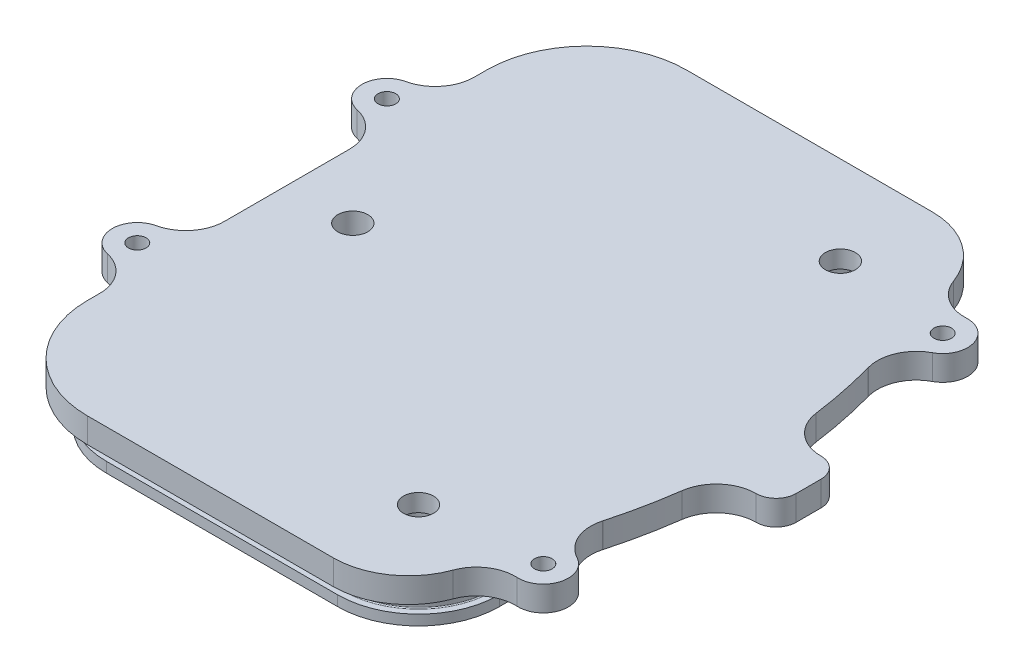
from build123d import *

# Parameters (mm, degrees)
SKETCH1_W           = 137.16
SKETCH1_H           = 152.4
BOSS_EXTRUDE1_DEPTH = 6.35
CUT_EXTRUDE1_DEPTH  = 6.35
FILLET1_R           = 25.4
FILLET2_R           = 19.05
FILLET3_R           = 127
SKETCH2_R           = 2.2479
CUT_EXTRUDE2_DEPTH  = 6.35
BOSS_EXTRUDE3_START = -6.35
BOSS_EXTRUDE3_DEPTH = 6.35
BOSS_EXTRUDE4_DEPTH = 8.7122
CUT_EXTRUDE3_START  = 2.54
SKETCH7_W           = 137.16
SKETCH7_H           = 152.4
CUT_EXTRUDE3_DEPTH  = 3.556
HOLE1_D             = 7.62
CUT_EXTRUDE4_DEPTH  = 10.6172
HOLE2_D             = 7.62
BOSS_EXTRUDE5_DEPTH = 10.6172
FILLET4_R           = 6.604
FILLET5_R           = 7.62
FILLET6_R           = 9.144
MIRROR2_START       = -15.0622
MIRROR2_DEPTH       = 10.6172
CHAMFER1_SIZE       = 1.016
FILLET7_R           = 0.254


# Read off the part's stored shape, not the designer's step: Mirror2
with BuildPart() as part:
    # Sketch1 → Boss-Extrude1 (new body)
    with BuildSketch(Plane(origin=(0, 0, 0), x_dir=(1, 0, 0), z_dir=(0, 1, 0))):
        Rectangle(SKETCH1_W, SKETCH1_H)
    extrude(amount=-BOSS_EXTRUDE1_DEPTH)

    # Sketch3 → Cut-Extrude1 (cut)
    with BuildSketch(Plane(origin=(0, 0, 0), x_dir=(1, 0, 0), z_dir=(0, 1, 0))):
        with BuildLine():
            Line((-54.821666667, 0), (-54.821666667, -15.887705084))
            ThreePointArc((-54.821666667, -15.887705084), (-56.994797895, -22.078955084), (-62.560729167, -25.553791048))
            ThreePointArc((-62.560729167, -25.553791048), (-67.521666667, -31.75), (-62.560729167, -37.946208952))
            ThreePointArc((-62.560729167, -37.946208952), (-56.994797895, -41.421044916), (-54.821666667, -47.612294916))
            Line((-54.821666667, -47.612294916), (-54.821666667, -76.2))
            Line((-54.821666667, -76.2), (-68.58, -76.2))
            Line((-68.58, -76.2), (-68.58, 0))
            Line((-68.58, 0), (-54.821666667, 0))
        make_face()
        with BuildLine():
            Line((68.58, 0), (59.262686671, -33.820874717))
            ThreePointArc((59.262686671, -33.820874717), (59.713399713, -40.366937171), (64.156526503, -45.195259885))
            ThreePointArc((64.156526503, -45.195259885), (67.293603318, -52.486532428), (60.865154116, -57.142598053))
            ThreePointArc((60.865154116, -57.142598053), (54.576224637, -59.014346409), (50.836773359, -64.406060426))
            Line((50.836773359, -64.406060426), (47.587660753, -76.2))
            Line((47.587660753, -76.2), (68.58, -76.2))
            Line((68.58, -76.2), (68.58, 0))
        make_face()
    cut_extrude1 = extrude(amount=-CUT_EXTRUDE1_DEPTH, mode=Mode.SUBTRACT)

    # Mirror1: Cut-Extrude1 across plane
    add(cut_extrude1.mirror(Plane(origin=(-54.821666667, -85.388713977, 0), x_dir=(1, 0, 0), z_dir=(0, 0, -1))), mode=Mode.SUBTRACT)

    # Fillet1
    fillet1_edges = [part.edges().sort_by_distance(p)[0] for p in [
        (-54.821666667, -3.175, 76.2),
        (-54.821666667, -3.175, -76.2),
    ]]
    fillet(fillet1_edges, radius=FILLET1_R)

    # Fillet2
    fillet2_edges = [part.edges().sort_by_distance(p)[0] for p in [
        (47.587660753, -3.175, -76.2),
        (47.587660753, -3.175, 76.2),
    ]]
    fillet(fillet2_edges, radius=FILLET2_R)

    # Fillet3
    fillet3_edges = [part.edges().sort_by_distance(p)[0] for p in [
        (68.58, -3.175, 0),
    ]]
    fillet(fillet3_edges, radius=FILLET3_R)

    # Sketch2 → Cut-Extrude2 (cut)
    with BuildSketch(Plane(origin=(0, 0, 0), x_dir=(1, 0, 0), z_dir=(0, 1, 0))):
        with Locations(Location((-61.171666667, 31.75, 0), (0, 0, 270))):
            Circle(SKETCH2_R)
        with Locations(Location((-61.171666667, -31.75, 0), (0, 0, 270))):
            Circle(SKETCH2_R)
        with Locations(Location((61.171666667, 50.8, 0), (0, 0, 270))):
            Circle(SKETCH2_R)
        with Locations(Location((61.171666667, -50.8, 0), (0, 0, 270))):
            Circle(SKETCH2_R)
    extrude(amount=-CUT_EXTRUDE2_DEPTH, mode=Mode.SUBTRACT)

    # Sketch4 → Boss-Extrude3 (add)
    with BuildSketch(Plane(origin=(0, 0, 0), x_dir=(1, 0, 0), z_dir=(0, 1, 0)).offset(BOSS_EXTRUDE3_START)):
        with BuildLine():
            Line((77.846996368, 3.175), (77.846996368, -3.175))
            ThreePointArc((77.846996368, -3.175), (76.359098817, -6.767102448), (72.766996368, -8.255))
            ThreePointArc((72.766996368, -8.255), (66.082439262, -10.763706234), (62.698982566, -17.050925926))
            ThreePointArc((62.698982566, -17.050925926), (63.848810039, 0), (62.698982566, 17.050925926))
            ThreePointArc((62.698982566, 17.050925926), (66.082439262, 10.763706234), (72.766996368, 8.255))
            ThreePointArc((72.766996368, 8.255), (76.359098817, 6.767102448), (77.846996368, 3.175))
        make_face()
    extrude(amount=BOSS_EXTRUDE3_DEPTH)

    # Sketch5 → Boss-Extrude4 (add)
    with BuildSketch(Plane.XZ.offset(6.35)):
        with BuildLine():
            Line((-49.970266667, 50.8), (-49.970266667, -50.8))
            ThreePointArc((-49.970266667, -50.8), (-43.951721071, -65.330054404), (-29.421666667, -71.3486))
            Line((-29.421666667, -71.3486), (29.421666667, -71.3486))
            ThreePointArc((29.421666667, -71.3486), (43.951721071, -65.330054404), (49.970266667, -50.8))
            Line((49.970266667, -50.8), (49.970266667, 50.8))
            ThreePointArc((49.970266667, 50.8), (43.951721071, 65.330054404), (29.421666667, 71.3486))
            Line((29.421666667, 71.3486), (-29.421666667, 71.3486))
            ThreePointArc((-29.421666667, 71.3486), (-43.951721071, 65.330054404), (-49.970266667, 50.8))
        make_face()
    extrude(amount=BOSS_EXTRUDE4_DEPTH)

    # Sketch7 → Cut-Extrude3 (cut)
    with BuildSketch(Plane.XZ.offset(6.35).offset(CUT_EXTRUDE3_START)):
        Rectangle(SKETCH7_W, SKETCH7_H)
        with BuildLine():
            Line((48.192266667, -50.8), (48.192266667, 50.8))
            ThreePointArc((48.192266667, 50.8), (42.694485214, 64.072818547), (29.421666667, 69.5706))
            Line((29.421666667, 69.5706), (-29.421666667, 69.5706))
            ThreePointArc((-29.421666667, 69.5706), (-42.694485214, 64.072818547), (-48.192266667, 50.8))
            Line((-48.192266667, 50.8), (-48.192266667, -50.8))
            ThreePointArc((-48.192266667, -50.8), (-42.694485214, -64.072818547), (-29.421666667, -69.5706))
            Line((-29.421666667, -69.5706), (29.421666667, -69.5706))
            ThreePointArc((29.421666667, -69.5706), (42.694485214, -64.072818547), (48.192266667, -50.8))
        make_face(mode=Mode.SUBTRACT)
    extrude(amount=CUT_EXTRUDE3_DEPTH, mode=Mode.SUBTRACT)

    # Hole1 (through all)
    with Locations(Plane.XZ.offset(15.0622)):
        with Locations((-38.1, 0)):
            Hole(HOLE1_D / 2)

    # Sketch11 → Cut-Extrude4 (cut)
    with BuildSketch(Plane.XZ.offset(15.0622)):
        with BuildLine():
            Line((-43.620266667, -8.529493298), (-43.620266667, -50.8))
            ThreePointArc((-43.620266667, -50.8), (-39.46159301, -60.839926343), (-29.421666667, -64.9986))
            Line((-29.421666667, -64.9986), (29.421666667, -64.9986))
            ThreePointArc((29.421666667, -64.9986), (39.46159301, -60.839926343), (43.620266667, -50.8))
            Line((43.620266667, -50.8), (43.620266667, 50.8))
            ThreePointArc((43.620266667, 50.8), (39.46159301, 60.839926343), (29.421666667, 64.9986))
            Line((29.421666667, 64.9986), (-29.421666667, 64.9986))
            ThreePointArc((-29.421666667, 64.9986), (-39.46159301, 60.839926343), (-43.620266667, 50.8))
            Line((-43.620266667, 50.8), (-43.620266667, 8.529493298))
            ThreePointArc((-43.620266667, 8.529493298), (-27.94, 0), (-43.620266667, -8.529493298))
        make_face()
    extrude(amount=-CUT_EXTRUDE4_DEPTH, mode=Mode.SUBTRACT)

    # Hole2 (through all)
    with Locations(Plane.XZ.offset(4.445)):
        with Locations((32.277388113, 53.655721447), (32.277388113, -53.655721447)):
            Hole(HOLE2_D / 2)

    # Sketch15 → Boss-Extrude5 (add)
    with BuildSketch(Plane.XZ.offset(4.445)):
        Polygon((20.847388113, 64.9986), (20.847388113, 42.225721446), (43.620266667, 42.225721446), (43.620266667, 44.765721446), (23.387388113, 44.765721446), (23.387388113, 64.9986), align=None)
    extrude(amount=BOSS_EXTRUDE5_DEPTH)

    # Fillet4
    fillet4_edges = [part.edges().sort_by_distance(p)[0] for p in [
        (43.620266667, -9.7536, 44.765721446),
        (23.387388113, -9.7536, 44.765721446),
        (23.387388113, -9.7536, 64.9986),
    ]]
    fillet(fillet4_edges, radius=FILLET4_R)

    # Fillet5
    fillet5_edges = [part.edges().sort_by_distance(p)[0] for p in [
        (-43.620266667, -9.7536, 8.529493298),
        (-43.620266667, -9.7536, -8.529493298),
        (43.620266667, -9.7536, 42.225721446),
        (20.847388113, -9.7536, 64.9986),
    ]]
    fillet(fillet5_edges, radius=FILLET5_R)

    # Fillet6
    fillet6_edges = [part.edges().sort_by_distance(p)[0] for p in [
        (20.847388113, -9.7536, 42.225721446),
    ]]
    fillet(fillet6_edges, radius=FILLET6_R)

    # Mirror2 outline → Mirror2 (add)
    with BuildSketch(Plane(origin=(0, 0, 0), x_dir=(1, 0, 0), z_dir=(0, 1, 0)).offset(MIRROR2_START)):
        with BuildLine():
            ThreePointArc((29.991388113, 44.765721447), (25.32165493, 46.699988264), (23.387388113, 51.369721447))
            Line((23.387388113, 51.369721447), (23.387388113, 64.9986))
            Line((23.387388113, 64.9986), (20.847388113, 64.9986))
            Line((20.847388113, 64.9986), (20.847388113, 51.369721447))
            ThreePointArc((20.847388113, 51.369721447), (23.525603705, 44.90393704), (29.991388113, 42.225721447))
            Line((29.991388113, 42.225721447), (36.000266667, 42.225721446))
            ThreePointArc((36.000266667, 42.225721446), (41.38842034, 39.993875119), (43.620266667, 34.605721446))
            Line((43.620266667, 34.605721446), (43.620266667, 50.8))
            ThreePointArc((43.620266667, 50.8), (43.610261227, 51.332941252), (43.580259007, 51.8651314))
            ThreePointArc((43.580259007, 51.8651314), (41.836587129, 46.878556304), (36.994867221, 44.765721447))
            Line((36.994867221, 44.765721447), (29.991388113, 44.765721447))
        make_face()
    extrude(amount=MIRROR2_DEPTH)

    # Chamfer1
    chamfer1_edges = [part.edges().sort_by_distance(p)[0] for p in [
        (-39.46159301, -15.0622, -60.839926343),
        (-4.287139277, -15.0622, -64.9986),
        (39.077671722, -15.0622, -61.209697802),
        (-39.46159301, -15.0622, 60.839926343),
        (-43.620266667, -15.0622, 34.227790209),
        (33.493127667, -15.0622, 44.765721446),
        (39.46159301, -15.0622, 60.839926343),
        (23.387388113, -15.0622, 54.871461),
        (41.836587129, -15.0622, 46.878556304),
        (25.32165493, -15.0622, 46.699988264),
        (25.500222971, -15.0622, 63.214920462),
        (-43.620266667, -15.0622, -34.227790209),
        (-27.94, -15.0622, 0),
        (32.99582739, -15.0622, 42.225721446),
        (-8.097139277, -15.0622, 64.9986),
        (-41.697701578, -15.0622, -12.595576918),
        (-41.697701578, -15.0622, 12.595576918),
        (41.388420339, -15.0622, 39.993875119),
        (18.615541786, -15.0622, 62.766753673),
        (20.847388113, -15.0622, 54.374160723),
        (23.525603706, -15.0622, 44.903937039),
        (26.40452739, -15.0622, -64.9986),
        (23.387388113, -15.0622, -58.184160723),
        (33.493127667, -15.0622, -44.765721447),
        (41.836587129, -15.0622, -46.878556304),
        (25.32165493, -15.0622, -46.699988264),
        (32.99582739, -15.0622, -42.225721447),
        (43.620266667, -15.0622, 0),
        (41.38842034, -15.0622, -39.993875119),
        (20.847388113, -15.0622, -58.184160723),
        (23.525603706, -15.0622, -44.90393704),
    ]]
    chamfer(chamfer1_edges, length=CHAMFER1_SIZE)

    # Fillet7
    fillet7_edges = [part.edges().sort_by_distance(p)[0] for p in [
        (42.694485214, -8.89, -64.072818547),
        (48.192266667, -8.89, 0),
        (42.694485214, -8.89, 64.072818547),
        (0, -8.89, 69.5706),
        (-42.694485214, -8.89, 64.072818547),
        (-48.192266667, -8.89, 0),
        (-42.694485214, -8.89, -64.072818547),
        (0, -8.89, -69.5706),
        (42.694485214, -12.446, -64.072818547),
        (48.192266667, -12.446, 0),
        (42.694485214, -12.446, 64.072818547),
        (0, -12.446, 69.5706),
        (-42.694485214, -12.446, 64.072818547),
        (-48.192266667, -12.446, 0),
        (-42.694485214, -12.446, -64.072818547),
        (0, -12.446, -69.5706),
    ]]
    fillet(fillet7_edges, radius=FILLET7_R)


solid = part.part
